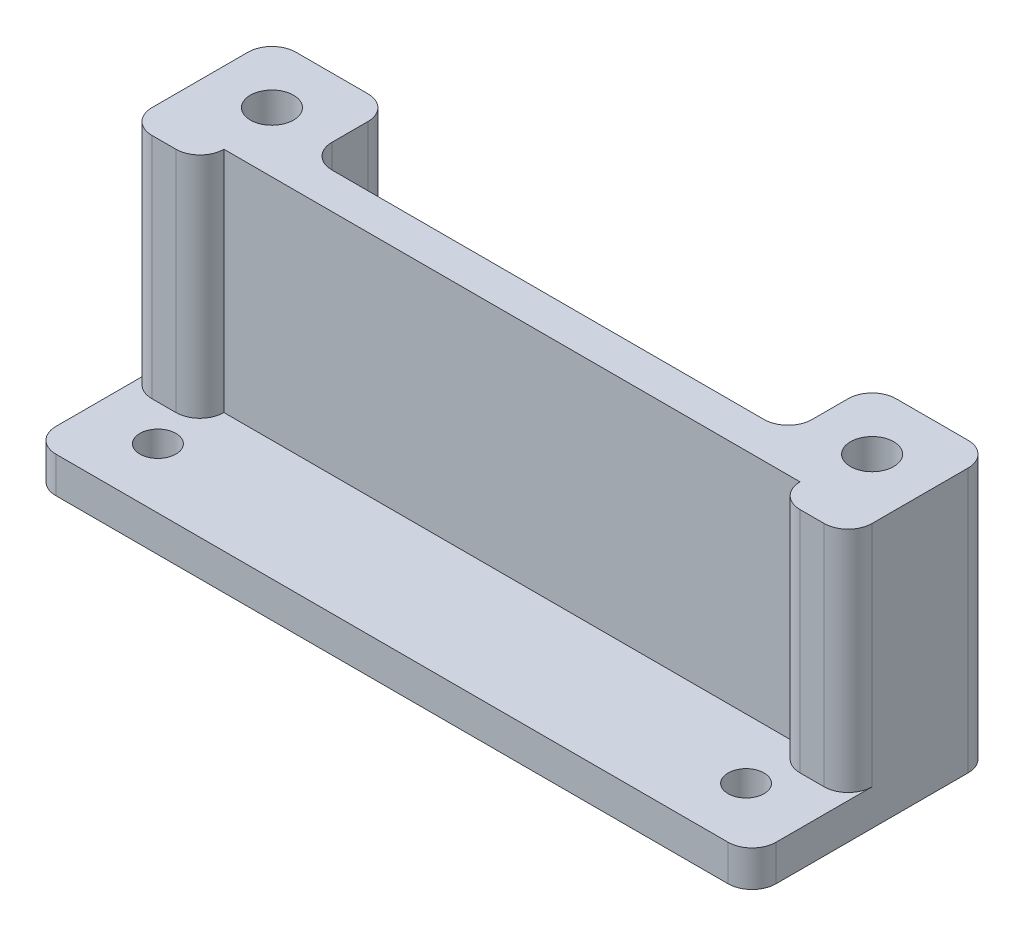
from build123d import *

# Parameters (mm, degrees)
SKETCH_1_W          = 60
SKETCH_1_H          = 20
SKETCH_1_R          = 1.5
SKETCH_1_R_2        = 1.8
EXTRUDE_1_DEPTH     = 3
SKETCH_7_W          = 60
SKETCH_7_H          = 10
EXTRUDE_3_DEPTH     = 19
SKETCH_8_R          = 1.8
CUT_EXTRUDE_3_DEPTH = 46.692815914
SKETCH_9_W          = 6
SKETCH_9_H          = 19
EXTRUDE_4_DEPTH     = 2
SKETCH_10_W         = 40
SKETCH_10_H         = 7
CUT_EXTRUDE_4_DEPTH = 48.019500488
FILLET_2_R          = 2


with BuildPart() as part:
    # ｽｹｯﾁ1 → ﾎﾞｽ - 押し出し1 (new body)
    with BuildSketch(Plane(origin=(0, 0, 0), x_dir=(1, 0, 0), z_dir=(0, 1, 0))):
        with Locations((2.380597015, -16.044776119)):
            Rectangle(SKETCH_1_W, SKETCH_1_H)
        with Locations(Location((-22.119402985, -21.044776119, 0), (0, 0, 270))):
            Circle(SKETCH_1_R, mode=Mode.SUBTRACT)
        with Locations(Location((26.880597015, -21.044776119, 0), (0, 0, 270))):
            Circle(SKETCH_1_R, mode=Mode.SUBTRACT)
        with Locations(Location((-22.619402985, -11.044776119, 0), (0, 0, 270))):
            Circle(SKETCH_1_R_2, mode=Mode.SUBTRACT)
        with Locations(Location((27.380597015, -11.044776119, 0), (0, 0, 270))):
            Circle(SKETCH_1_R_2, mode=Mode.SUBTRACT)
    extrude(amount=EXTRUDE_1_DEPTH)

    # ｽｹｯﾁ7 → ﾎﾞｽ - 押し出し3 (add)
    with BuildSketch(Plane(origin=(0, 3, 0), x_dir=(1, 0, 0), z_dir=(0, 1, 0))):
        with Locations((2.380597015, -11.044776119)):
            Rectangle(SKETCH_7_W, SKETCH_7_H)
    extrude(amount=EXTRUDE_3_DEPTH)

    # ｽｹｯﾁ8 → ｶｯﾄ - 押し出し3 (cut, through all)
    with BuildSketch(Plane.XZ.offset(-3)):
        with Locations(Location((27.380597015, 11.044776119, 0), (0, 0, 270))):
            Circle(SKETCH_8_R)
        with Locations(Location((-22.619402985, 11.044776119, 0), (0, 0, 270))):
            Circle(SKETCH_8_R)
    extrude(amount=-CUT_EXTRUDE_3_DEPTH, mode=Mode.SUBTRACT)

    # ｽｹｯﾁ9 → ﾎﾞｽ - 押し出し4 (add)
    with BuildSketch(Plane.XY.offset(16.044776119)):
        with Locations((29.380597015, 12.5)):
            Rectangle(SKETCH_9_W, SKETCH_9_H)
        with Locations((-24.619402985, 12.5)):
            Rectangle(SKETCH_9_W, SKETCH_9_H)
    extrude(amount=EXTRUDE_4_DEPTH)

    # ｽｹｯﾁ10 → ｶｯﾄ - 押し出し4 (cut, through all)
    with BuildSketch(Plane(origin=(0, 22, 0), x_dir=(1, 0, 0), z_dir=(0, 1, 0))):
        with Locations((2.380597015, -9.544776119)):
            Rectangle(SKETCH_10_W, SKETCH_10_H)
    extrude(amount=-CUT_EXTRUDE_4_DEPTH, mode=Mode.SUBTRACT)

    # ﾌｨﾚｯﾄ2
    fillet_2_edges = [part.edges().sort_by_distance(p)[0] for p in [
        (32.380597015, 12.5, 18.044776119),
        (26.380597015, 12.5, 18.044776119),
        (-27.619402985, 12.5, 18.044776119),
        (-21.619402985, 12.5, 18.044776119),
        (32.380597015, 1.5, 26.044776119),
        (-27.619402985, 1.5, 26.044776119),
        (-27.619402985, 11, 6.044776119),
        (32.380597015, 11, 6.044776119),
        (22.380597015, 11, 6.044776119),
        (22.380597015, 11, 13.044776119),
        (-17.619402985, 11, 13.044776119),
        (-17.619402985, 11, 6.044776119),
    ]]
    fillet(fillet_2_edges, radius=FILLET_2_R - 0.0001)  # a hair under: the kernel refuses the full size


solid = part.part
